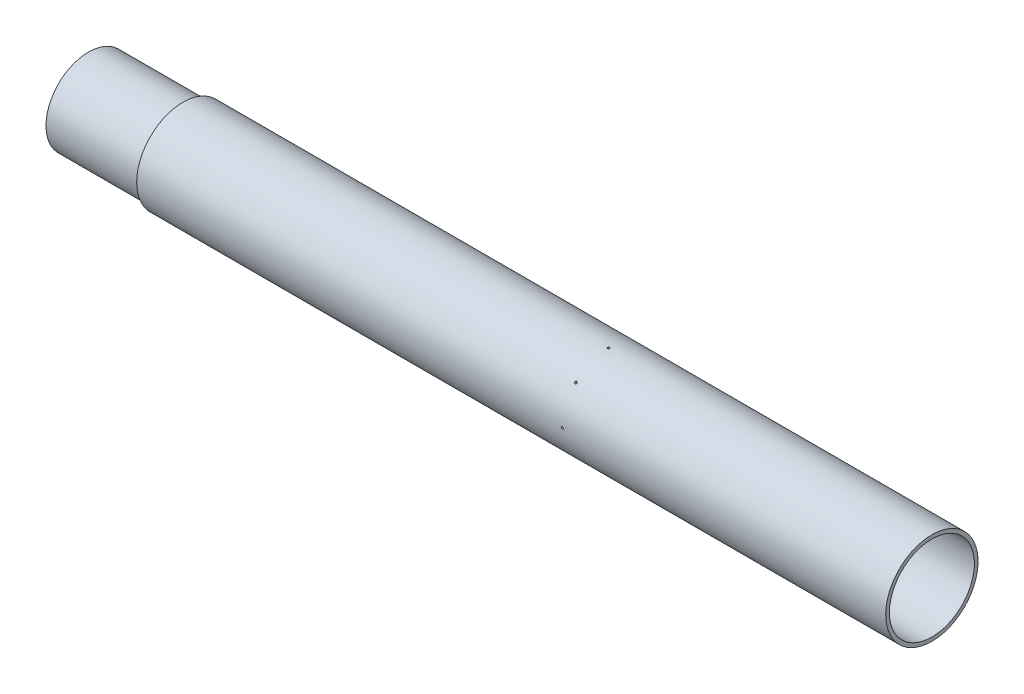
from build123d import *

# Parameters (mm, degrees)
SKETCH2_R          = 1.4224
CUT_EXTRUDE1_DEPTH = 20
CIRPATTERN1_COUNT  = 8


with BuildPart() as part:
    # Sketch1 → Revolve1 (revolve)
    with BuildSketch(Plane.XY):
        Polygon((-1238.910735908, 62.15), (-2246.556635908, 62.15), (-2246.556635908, 57.15), (-2373.556635908, 57.15), (-2373.556635908, 52.15), (-2119.556635908, 52.15), (-2119.556635908, 57.15), (-1238.910735908, 57.15), align=None)
    revolve(axis=Axis((-2246.556635908, 0, 0), (1, 0, 0)))

    # Sketch2 → Cut-Extrude1 (cut)
    with BuildSketch(Plane(origin=(0, 0, -62.15), x_dir=(-1, 0, 0), z_dir=(0, 0, -1))):
        with Locations((1673.910735908, 0)):
            Circle(SKETCH2_R)
    cut_extrude1 = extrude(amount=-CUT_EXTRUDE1_DEPTH, mode=Mode.SUBTRACT)

    # CirPattern1: Cut-Extrude1 ×8 about axis
    cirpattern1_axis = Axis((-1238.910735908, 0, 0), (-1, 0, 0))
    for i in range(1, CIRPATTERN1_COUNT):
        add(cut_extrude1.rotate(cirpattern1_axis, i * 360 / CIRPATTERN1_COUNT), mode=Mode.SUBTRACT)


solid = part.part
